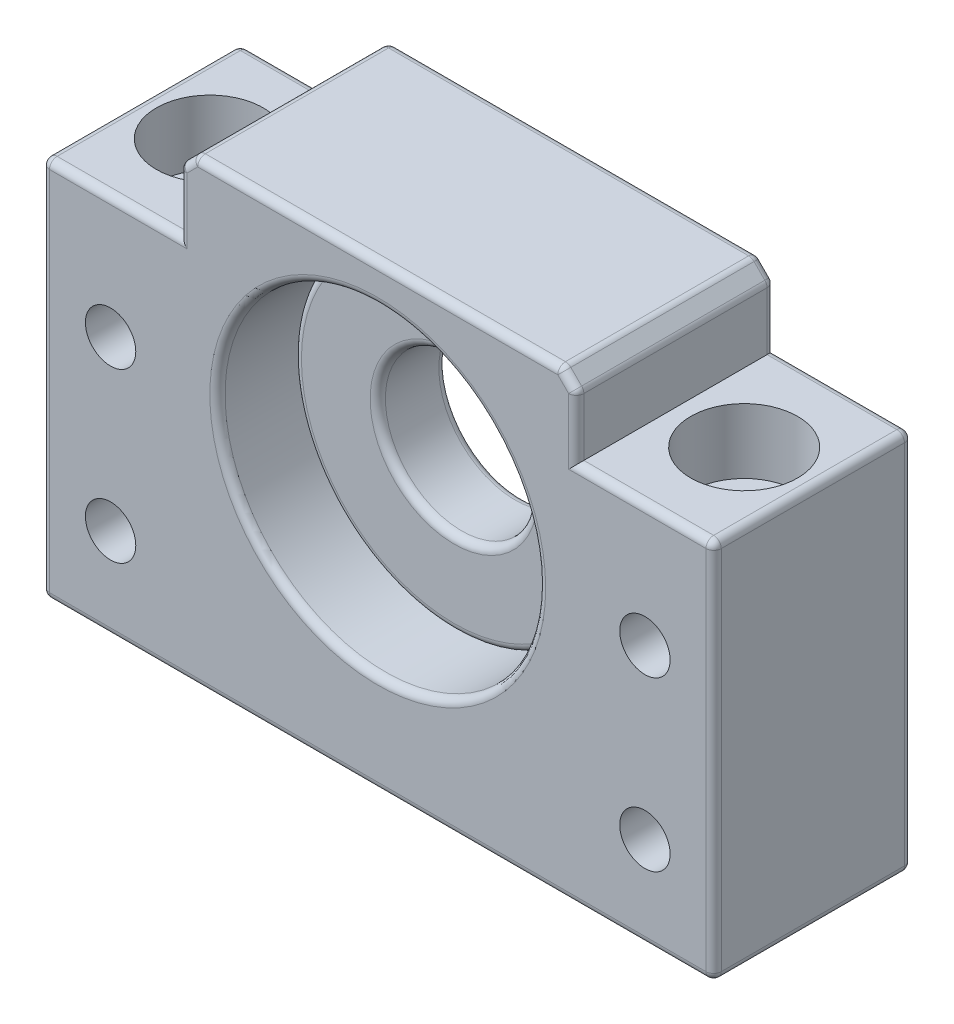
from build123d import *

# Parameters (mm, degrees)
BOSS_EXTRUDE1_DEPTH = 26
SKETCH12_R          = 4.5
CUT_EXTRUDE3_DEPTH  = 100
SKETCH13_R          = 3.3
SKETCH13_R_2        = 21
CUT_EXTRUDE4_DEPTH  = 50
SKETCH14_R          = 7
CUT_EXTRUDE5_DEPTH  = 8.5
BOSS_EXTRUDE3_START = 7
SKETCH16_R          = 21
SKETCH16_R_2        = 10
BOSS_EXTRUDE3_DEPTH = 9
CHAMFER1_SIZE       = 2
FILLET1_R           = 1
FILLET2_R           = 1


with BuildPart() as part:
    # Sketch2 → Boss-Extrude1 (new body)
    with BuildSketch(Plane.XY):
        Polygon((-44, 16), (-26, 16), (-26, 26), (26, 26), (26, 16), (44, 16), (44, -34), (-44, -34), align=None)
    extrude(amount=BOSS_EXTRUDE1_DEPTH)

    # Sketch12 → Cut-Extrude3 (cut)
    with BuildSketch(Plane(origin=(0, 16, 0), x_dir=(1, 0, 0), z_dir=(0, 1, 0))):
        with Locations((-35, -13)):
            Circle(SKETCH12_R)
        with Locations((35, -13)):
            Circle(SKETCH12_R)
    extrude(amount=-CUT_EXTRUDE3_DEPTH, mode=Mode.SUBTRACT)

    # Sketch13 → Cut-Extrude4 (cut)
    with BuildSketch(Plane.XY):
        with Locations((-35, 0)):
            Circle(SKETCH13_R)
        with Locations((-35, -22)):
            Circle(SKETCH13_R)
        with Locations((35, -22)):
            Circle(SKETCH13_R)
        with Locations((35, 0)):
            Circle(SKETCH13_R)
        Circle(SKETCH13_R_2)
    extrude(amount=CUT_EXTRUDE4_DEPTH, mode=Mode.SUBTRACT)

    # Sketch14 → Cut-Extrude5 (cut)
    with BuildSketch(Plane(origin=(0, 16, 0), x_dir=(1, 0, 0), z_dir=(0, 1, 0))):
        with Locations((-35, -13)):
            Circle(SKETCH14_R)
        with Locations((35, -13)):
            Circle(SKETCH14_R)
    extrude(amount=-CUT_EXTRUDE5_DEPTH, mode=Mode.SUBTRACT)

    # Chamfer1
    chamfer1_edges = [part.edges().sort_by_distance(p)[0] for p in [
        (-26, 26, 13),
        (26, 26, 13),
    ]]
    chamfer(chamfer1_edges, length=CHAMFER1_SIZE)

    # Fillet1
    fillet1_edges = [part.edges().sort_by_distance(p)[0] for p in [
        (-21, 0, 0),
        (-21, 0, 26),
        (44, -34, 13),
        (-44, -34, 13),
        (-44, 16, 13),
        (44, 16, 13),
        (-35, 16, 26),
        (-35, 16, 0),
        (0, 26, 26),
        (0, 26, 0),
        (35, 16, 26),
        (35, 16, 0),
        (0, -34, 26),
        (0, -34, 0),
        (-44, -9, 26),
        (-44, -9, 0),
        (44, -9, 26),
        (44, -9, 0),
        (25, 25, 0),
        (26, 20, 0),
        (26, 20, 26),
        (25, 25, 26),
        (-26, 20, 0),
        (-25, 25, 0),
        (-26, 20, 26),
        (-25, 25, 26),
        (26, 24, 13),
        (24, 26, 13),
        (-26, 24, 13),
        (-24, 26, 13),
    ]]
    fillet(fillet1_edges, radius=FILLET1_R)


with BuildPart() as body_2:
    # Sketch16 → Boss-Extrude3 (new body)
    with BuildSketch(Plane.XY.offset(BOSS_EXTRUDE3_START)):
        Circle(SKETCH16_R)
        Circle(SKETCH16_R_2, mode=Mode.SUBTRACT)
    extrude(amount=BOSS_EXTRUDE3_DEPTH)

    # Fillet2
    fillet2_edges = [body_2.edges().sort_by_distance(p)[0] for p in [
        (-10, 0, 16),
        (-10, 0, 7),
        (-21, 0, 7),
        (-21, 0, 16),
    ]]
    fillet(fillet2_edges, radius=FILLET2_R)


solid = Compound([part.part, body_2.part])
